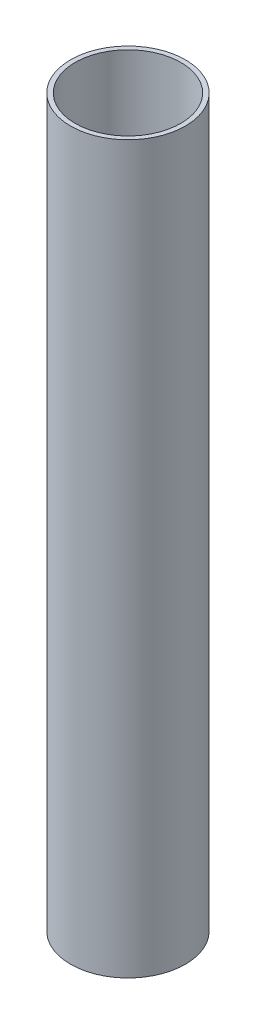
from build123d import *

# Parameters (mm, degrees)
SKETCH_1_R      = 25
SKETCH_1_R_2    = 23
EXTRUDE_1_DEPTH = 316


with BuildPart() as part:
    # Эскиз1 → Бобышка-Вытянуть1 (new body)
    with BuildSketch(Plane(origin=(0, 0, 0), x_dir=(1, 0, 0), z_dir=(0, 1, 0))):
        Circle(SKETCH_1_R)
        Circle(SKETCH_1_R_2, mode=Mode.SUBTRACT)
    extrude(amount=EXTRUDE_1_DEPTH)


solid = part.part
